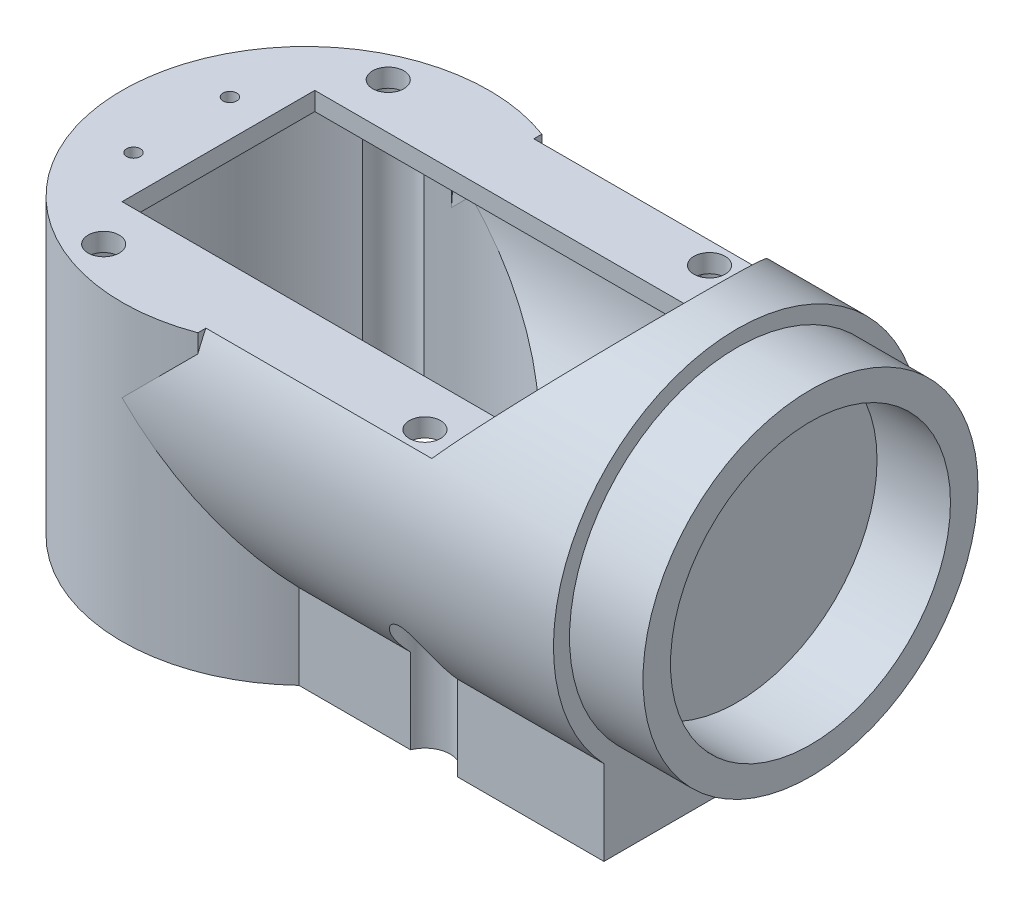
from build123d import *
from build123d.topology import SkipClean

# Parameters (mm, degrees)
EXTRUDE_1_DEPTH      = 30
EXTRUDE_START        = -40
EXTRUDE_5_DEPTH      = 40
CUT_EXTRUDE_START    = -42
SKETCH_11_R          = 18
CUT_EXTRUDE_2_DEPTH  = 42
CUT_EXTRUDE_3_DEPTH  = 20
CUT_EXTRUDE_6_DEPTH  = 30
EXTRUDE_7_DEPTH      = 5
EXTRUDE_7_DEPTH_BACK = 10
SKETCH_14_R          = 0.75
SKETCH_14_W          = 41
SKETCH_14_H          = 21
EXTRUDE_9_DEPTH      = 2
SKETCH_18_R          = 20.85
CUT_EXTRUDE_8_DEPTH  = 20
CUT_EXTRUDE_START_2  = -38
CUT_EXTRUDE_10_DEPTH = 38
EXTRUDE_10_DEPTH     = 5
EXTRUDE_11_DEPTH     = 2
SKETCH_22_R          = 18.25
SKETCH_22_R_2        = 15.25
EXTRUDE_13_DEPTH     = 8
SKETCH_29_R          = 1.7
CUT_EXTRUDE_13_DEPTH = 73.622310708
SKETCH_30_R          = 2.75
CUT_EXTRUDE_14_DEPTH = 30


# Read off the part's stored shape, not the designer's step: 凸台-拉伸5
with BuildPart() as part:
    # 草图1 → 凸台-拉伸1 (new body)
    with BuildSketch(Plane(origin=(0, 0, 0), x_dir=(1, 0, 0), z_dir=(0, 1, 0))):
        with BuildLine():
            Line((40, 12.5), (12.951833847, 12.5))
            ThreePointArc((12.951833847, 12.5), (-18, 0), (12.951833847, -12.5))
            Line((12.951833847, -12.5), (40, -12.5))
            Line((40, -12.5), (40, -14.5))
            Line((40, -14.5), (13.774977314, -14.5))
            ThreePointArc((13.774977314, -14.5), (-20, 0), (13.774977314, 14.5))
            Line((13.774977314, 14.5), (40, 14.5))
            Line((40, 14.5), (40, 12.5))
        make_face()
    extrude(amount=EXTRUDE_1_DEPTH)

    # 凸台-拉伸5 outline → 凸台-拉伸5 (add)
    with BuildSketch(Plane(origin=(40, 0, 0), x_dir=(0, 0, -1), z_dir=(1, 0, 0)).offset(EXTRUDE_START)):
        with BuildLine():
            ThreePointArc((14.5, 9.225022686), (0, 43), (-14.5, 9.225022686))
            ThreePointArc((-14.5, 9.225022686), (0, 3), (14.5, 9.225022686))
        make_face()
        with BuildLine():
            ThreePointArc((14.5, 12.334635496), (0, 5), (-14.5, 12.334635496))
            ThreePointArc((-14.5, 12.334635496), (0, 41), (14.5, 12.334635496))
        make_face(mode=Mode.SUBTRACT)
    extrude(amount=EXTRUDE_5_DEPTH)

    # 草图11 → 切除-拉伸2 (cut)
    with BuildSketch(Plane(origin=(40, 0, 0), x_dir=(0, 0, -1), z_dir=(1, 0, 0)).offset(CUT_EXTRUDE_START)):
        with Locations((0, 23)):
            Circle(SKETCH_11_R)
    extrude(amount=CUT_EXTRUDE_2_DEPTH, mode=Mode.SUBTRACT)

    # 草图10 → 切除-拉伸3 (cut)
    with BuildSketch(Plane(origin=(0, 30, 0), x_dir=(1, 0, 0), z_dir=(0, 1, 0))):
        with BuildLine():
            Line((0, 20), (40, 20))
            Line((40, 20), (40, -20))
            Line((40, -20), (0, -20))
            ThreePointArc((0, -20), (-20, 0), (0, 20))
        make_face()
    extrude(amount=CUT_EXTRUDE_3_DEPTH, mode=Mode.SUBTRACT)

    # 草图13 → 切除-拉伸6 (cut)
    with SkipClean():  # the faces are left unmerged after this step: merging them gives an invalid solid
        with BuildSketch(Plane.XZ):
            with BuildLine():
                Line((40, -12.5), (12.951833847, -12.5))
                ThreePointArc((12.951833847, -12.5), (-18, 0), (12.951833847, 12.5))
                Line((12.951833847, 12.5), (40, 12.5))
                Line((40, 12.5), (40, -12.5))
            make_face()
        extrude(amount=-CUT_EXTRUDE_6_DEPTH, mode=Mode.SUBTRACT)

    # 草图15 → 凸台-拉伸7 (add, two sides: drawn at the far end of the back side and taken through both)
    with SkipClean():  # the faces are left unmerged after this step: merging them gives an invalid solid
        with BuildSketch(Plane(origin=(40, 0, 0), x_dir=(0, 0, -1), z_dir=(1, 0, 0)).offset(-EXTRUDE_7_DEPTH_BACK)):
            with BuildLine():
                Line((12.5, 10.048166153), (12.5, 7.387505004))
                ThreePointArc((12.5, 7.387505004), (0, 43), (-12.5, 7.387505004))
                Line((-12.5, 7.387505004), (-12.5, 10.048166153))
                ThreePointArc((-12.5, 10.048166153), (0, 41), (12.5, 10.048166153))
            make_face()
        extrude(amount=EXTRUDE_7_DEPTH + EXTRUDE_7_DEPTH_BACK)

    # 草图14 → 凸台-拉伸9 (add)
    # profile 1 of 2: a face of its own
    with SkipClean():  # the faces are left unmerged after this step: merging them gives an invalid solid
        with BuildSketch(Plane(origin=(0, 30, 0), x_dir=(1, 0, 0), z_dir=(0, 1, 0))):
            with BuildLine():
                Line((7, -18.734993995), (30, -18.734993995))
                Line((30, -18.734993995), (30, -16.583123952))
                Line((30, -16.583123952), (7, -16.583123952))
                ThreePointArc((7, -16.583123952), (-18, 0), (7, 16.583123952))
                Line((7, 16.583123952), (30, 16.583123952))
                Line((30, 16.583123952), (30, 18.734993995))
                Line((30, 18.734993995), (7, 18.734993995))
                ThreePointArc((7, 18.734993995), (-20, 0), (7, -18.734993995))
            make_face()
        # profile 2 of 2: a face of its own
        with BuildSketch(Plane(origin=(0, 30, 0), x_dir=(1, 0, 0), z_dir=(0, 1, 0))):
            with BuildLine():
                Line((40, 16.583123952), (40, -16.583123952))
                Line((40, -16.583123952), (7, -16.583123952))
                ThreePointArc((7, -16.583123952), (-18, 0), (7, 16.583123952))
                Line((7, 16.583123952), (40, 16.583123952))
            make_face()
            with Locations(Location((-13.5, 5.25, 0), (0, 0, 270))):
                Circle(SKETCH_14_R, mode=Mode.SUBTRACT)
            with Locations(Location((-13.5, -5.25, 0), (0, 0, 270))):
                Circle(SKETCH_14_R, mode=Mode.SUBTRACT)
            with Locations(Location((35.5, 5.25, 0), (0, 0, 270))):
                Circle(SKETCH_14_R, mode=Mode.SUBTRACT)
            with Locations(Location((35.5, -5.25, 0), (0, 0, 270))):
                Circle(SKETCH_14_R, mode=Mode.SUBTRACT)
            with Locations((11, 0)):
                Rectangle(SKETCH_14_W, SKETCH_14_H, mode=Mode.SUBTRACT)
        extrude(amount=EXTRUDE_9_DEPTH)

    # 草图18 → 切除-拉伸8 (cut)
    with SkipClean():  # the faces are left unmerged after this step: merging them gives an invalid solid
        with BuildSketch(Plane(origin=(0, 32, 0), x_dir=(1, 0, 0), z_dir=(0, 1, 0))):
            with Locations((20.85, 0)):
                Circle(SKETCH_18_R)
        extrude(amount=CUT_EXTRUDE_8_DEPTH, mode=Mode.SUBTRACT)

    # 草图19 → 切除-拉伸10 (cut)
    with SkipClean():  # the faces are left unmerged after this step: merging them gives an invalid solid
        with BuildSketch(Plane(origin=(45, 0, 0), x_dir=(0, 0, -1), z_dir=(1, 0, 0)).offset(CUT_EXTRUDE_START_2)):
            with BuildLine():
                Line((-17.860571099, 32), (-18.734993995, 32))
                Line((-18.734993995, 32), (-18.734993995, 30))
                ThreePointArc((-18.734993995, 30), (-18.325087889, 31.011938208), (-17.860571099, 32))
            make_face()
            with BuildLine():
                Line((18.734993995, 32), (17.860571099, 32))
                ThreePointArc((17.860571099, 32), (18.325087889, 31.011938208), (18.734993995, 30))
                Line((18.734993995, 30), (18.734993995, 32))
            make_face()
        extrude(amount=CUT_EXTRUDE_10_DEPTH, mode=Mode.SUBTRACT)

    # 草图20 → 凸台-拉伸10 (add)
    with SkipClean():  # the faces are left unmerged after this step: merging them gives an invalid solid
        with BuildSketch(Plane(origin=(40, 0, 0), x_dir=(0, 0, -1), z_dir=(1, 0, 0))):
            with BuildLine():
                Line((-14.5, 9.225022686), (-14.5, 0))
                Line((-14.5, 0), (-12.5, 0))
                Line((-12.5, 0), (-12.5, 7.387505004))
                ThreePointArc((-12.5, 7.387505004), (-13.531227506, 8.27227505), (-14.5, 9.225022686))
            make_face()
            with BuildLine():
                Line((12.5, 7.387505004), (12.5, 0))
                Line((12.5, 0), (14.5, 0))
                Line((14.5, 0), (14.5, 9.225022686))
                ThreePointArc((14.5, 9.225022686), (13.531227506, 8.27227505), (12.5, 7.387505004))
            make_face()
            with BuildLine():
                Line((-16.583123952, 30), (16.583123952, 30))
                ThreePointArc((16.583123952, 30), (16.11684397, 31.015443871), (15.588457268, 32))
                Line((15.588457268, 32), (-15.588457268, 32))
                ThreePointArc((-15.588457268, 32), (-16.11684397, 31.015443871), (-16.583123952, 30))
            make_face()
        extrude(amount=EXTRUDE_10_DEPTH)

    # 草图21 → 凸台-拉伸11 (add)
    with SkipClean():  # the faces are left unmerged after this step: merging them gives an invalid solid
        with BuildSketch(Plane(origin=(45, 0, 0), x_dir=(0, 0, -1), z_dir=(1, 0, 0))):
            with BuildLine():
                Line((-14.5, 0), (14.5, 0))
                Line((14.5, 0), (14.5, 9.225022686))
                ThreePointArc((14.5, 9.225022686), (0, 43), (-14.5, 9.225022686))
                Line((-14.5, 9.225022686), (-14.5, 0))
            make_face()
        extrude(amount=EXTRUDE_11_DEPTH)

    # 草图22 → 凸台-拉伸13 (add)
    with SkipClean():  # the faces are left unmerged after this step: merging them gives an invalid solid
        with BuildSketch(Plane(origin=(47, 0, 0), x_dir=(0, 0, -1), z_dir=(1, 0, 0))):
            with Locations((0, 23)):
                Circle(SKETCH_22_R)
            with Locations((0, 23)):
                Circle(SKETCH_22_R_2, mode=Mode.SUBTRACT)
        extrude(amount=EXTRUDE_13_DEPTH)

    # 草图29 → 切除-拉伸13 (cut, through all)
    with SkipClean():  # the faces are left unmerged after this step: merging them gives an invalid solid
        with BuildSketch(Plane.XZ):
            with Locations(Location((-6.5, -15.5, 0), (0, 0, 90))):
                Circle(SKETCH_29_R)
            with Locations(Location((28.5, -15.5, 0), (0, 0, 90))):
                Circle(SKETCH_29_R)
            with Locations(Location((28.5, 15.5, 0), (0, 0, 90))):
                Circle(SKETCH_29_R)
            with Locations(Location((-6.5, 15.5, 0), (0, 0, 90))):
                Circle(SKETCH_29_R)
        extrude(amount=-CUT_EXTRUDE_13_DEPTH, mode=Mode.SUBTRACT)

    # 草图30 → 切除-拉伸14 (cut)
    with SkipClean():  # the faces are left unmerged after this step: merging them gives an invalid solid
        with BuildSketch(Plane.XZ):
            with Locations((-6.5, -15.5)):
                Circle(SKETCH_30_R)
            with Locations(Location((28.5, -15.5, 0), (0, 0, 203.195097041))):
                Circle(SKETCH_30_R)
            with Locations(Location((28.5, 15.5, 0), (0, 0, 338.676313737))):
                Circle(SKETCH_30_R)
            with Locations((-6.5, 15.5)):
                Circle(SKETCH_30_R)
        extrude(amount=-CUT_EXTRUDE_14_DEPTH, mode=Mode.SUBTRACT)


solid = part.part
